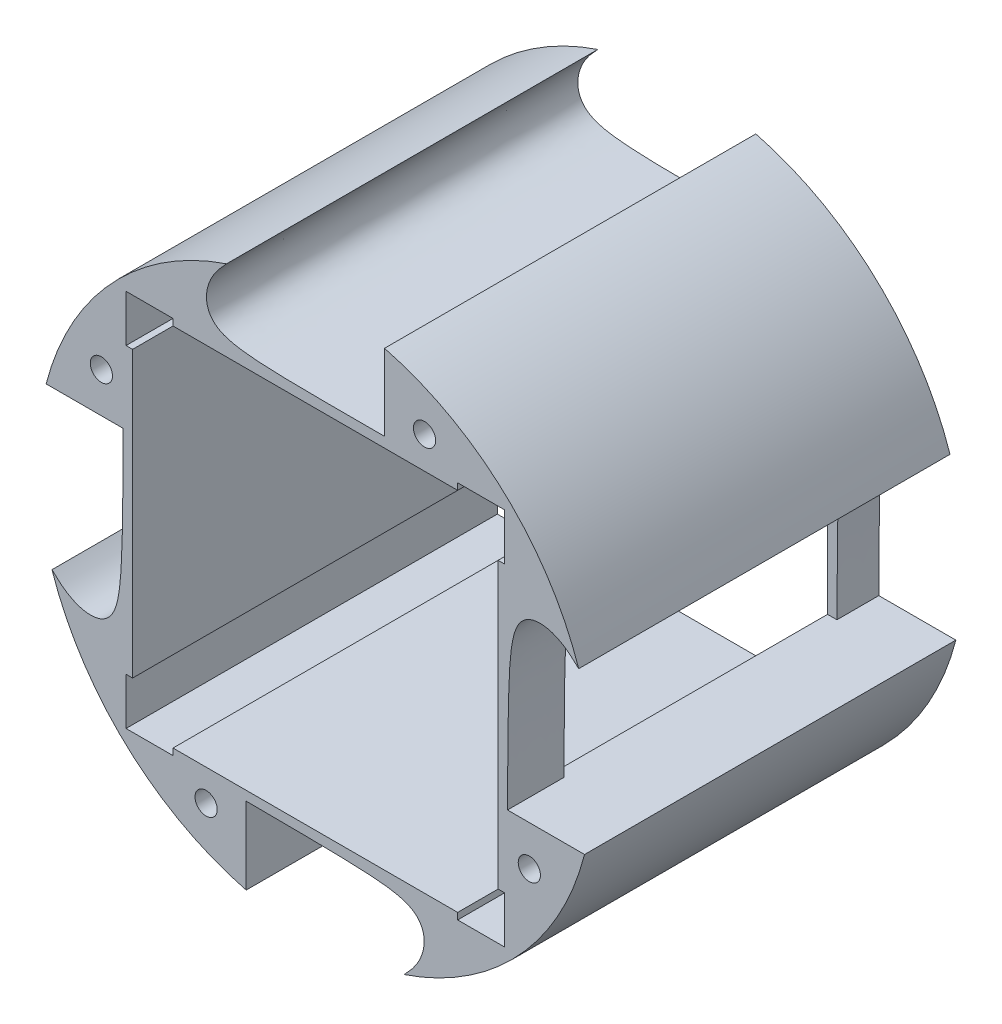
from build123d import *

# Parameters (mm, degrees)
BOSS_EXTRUDE3_OUTLINE_R = 3
BOSS_EXTRUDE3_DEPTH     = 102
CUT_EXTRUDE1_DEPTH      = 102
CUT_EXTRUDE2_DEPTH      = 102
SKETCH4_W               = 0.4
SKETCH4_H               = 1.8
SKETCH4_W_2             = 1.8
SKETCH4_H_2             = 0.4
BOSS_EXTRUDE4_DEPTH     = 102
SKETCH5_W               = 75
SKETCH5_H               = 43.392810524
CUT_EXTRUDE6_DEPTH      = 10
SKETCH7_R               = 3.05
CUT_EXTRUDE9_DEPTH      = 147.084376475


# Read off the part's stored shape, not the designer's step: Boss-Extrude3
with BuildPart() as part:
    # Boss-Extrude3 outline → Boss-Extrude3 (new body)
    with BuildSketch(Plane.XY):
        with BuildLine():
            add(Edge.make_bspline(
                [(24.392810524, -72.348554199), (27.040667073, -69.541086329), (29.089162938, -67.428574969), (30.241441862, -64.355831171), (31.073643307, -60.963009895), (30.561519341, -59.042545022), (29.217193929, -56.673971678), (27.488775543, -54.241382838), (25.105954954, -53), (17.37432721, -53), (-19, -52.782560411)],
                knots=[0, 0, 0, 0, 0, 0, 0, 0, 0, 0, 0, 1, 1, 1, 1, 1, 1, 1, 1, 1, 1, 1], degree=10))
            ThreePointArc((24.392810524, -72.348554199), (55.939709188, -51.962211615), (73.948106805, -19))
            Line((73.948106805, -19), (52.782560411, -19))
            add(Edge.make_bspline(
                [(72.348554199, 24.392810524), (69.541086329, 27.040667073), (67.428574969, 29.089162938), (64.355831171, 30.241441862), (60.963009895, 31.073643307), (59.042545022, 30.561519341), (56.673971678, 29.217193929), (54.241382838, 27.488775543), (53, 25.105954954), (53, 17.37432721), (52.782560411, -19)],
                knots=[0, 0, 0, 0, 0, 0, 0, 0, 0, 0, 0, 1, 1, 1, 1, 1, 1, 1, 1, 1, 1, 1], degree=10))
            ThreePointArc((72.348554199, 24.392810524), (51.962211615, 55.939709188), (19, 73.948106805))
            Line((19, 73.948106805), (19, 53))
            add(Edge.make_bspline(
                [(-24.392810524, 72.348554199), (-27.040667073, 69.541086329), (-29.089162938, 67.428574969), (-30.241441862, 64.355831171), (-31.073643307, 60.963009895), (-30.561519341, 59.042545022), (-29.217193929, 56.673971678), (-27.488775543, 54.241382838), (-25.105954954, 53), (-17.37432721, 53), (19, 53)],
                knots=[0, 0, 0, 0, 0, 0, 0, 0, 0, 0, 0, 1, 1, 1, 1, 1, 1, 1, 1, 1, 1, 1], degree=10))
            ThreePointArc((-24.392810524, 72.348554199), (-55.939709188, 51.962211615), (-73.948106805, 19))
            Line((-73.948106805, 19), (-52.782560411, 19))
            add(Edge.make_bspline(
                [(-72.348554199, -24.392810524), (-69.541086329, -27.040667073), (-67.428574969, -29.089162938), (-64.355831171, -30.241441862), (-60.963009895, -31.073643307), (-59.042545022, -30.561519341), (-56.673971678, -29.217193929), (-54.241382838, -27.488775543), (-53, -25.105954954), (-53, -17.37432721), (-52.782560411, 19)],
                knots=[0, 0, 0, 0, 0, 0, 0, 0, 0, 0, 0, 1, 1, 1, 1, 1, 1, 1, 1, 1, 1, 1], degree=10))
            ThreePointArc((-72.348554199, -24.392810524), (-51.962211615, -55.939709188), (-19, -73.948106805))
            Line((-19, -73.948106805), (-19, -52.782560411))
        make_face()
        with Locations((-30, -58.782560411)):
            Circle(BOSS_EXTRUDE3_OUTLINE_R, mode=Mode.SUBTRACT)
        with Locations((58.782560411, -30)):
            Circle(BOSS_EXTRUDE3_OUTLINE_R, mode=Mode.SUBTRACT)
        with Locations((-58.782560411, 30)):
            Circle(BOSS_EXTRUDE3_OUTLINE_R, mode=Mode.SUBTRACT)
        Polygon((-38.9, -51.6), (-51.6, -51.6), (-51.6, -38.9), (-50, -38.9), (-50, 38.9), (-51.6, 38.9), (-51.6, 51.6), (-38.9, 51.6), (-38.9, 50), (38.9, 50), (38.9, 51.6), (51.6, 51.6), (51.6, 38.9), (50, 38.9), (50, -38.9), (51.6, -38.9), (51.6, -51.6), (38.9, -51.6), (38.9, -50), (-38.9, -50), align=None, mode=Mode.SUBTRACT)
        with Locations((30, 59)):
            Circle(BOSS_EXTRUDE3_OUTLINE_R, mode=Mode.SUBTRACT)
    extrude(amount=BOSS_EXTRUDE3_DEPTH)

    # Sketch2 → Cut-Extrude1 (cut)
    with BuildSketch(Plane.XY.offset(102)):
        Polygon((51.8, -38.7), (50.2, -38.7), (50.2, 38.7), (51.8, 38.7), (51.8, 51.8), (38.7, 51.8), (38.7, 50.2), (-38.7, 50.2), (-38.7, 51.8), (-51.8, 51.8), (-51.8, 38.7), (-50.2, 38.7), (-50.2, -38.7), (-51.8, -38.7), (-51.8, -51.8), (-38.7, -51.8), (-38.7, -50.2), (38.7, -50.2), (38.7, -51.8), (51.8, -51.8), align=None)
        Polygon((51.6, -38.9), (50, -38.9), (50, 38.9), (51.6, 38.9), (51.6, 51.6), (38.9, 51.6), (38.9, 50), (-38.9, 50), (-38.9, 51.6), (-51.6, 51.6), (-51.6, 38.9), (-50, 38.9), (-50, -38.9), (-51.6, -38.9), (-51.6, -51.6), (-38.9, -51.6), (-38.9, -50), (38.9, -50), (38.9, -51.6), (51.6, -51.6), align=None, mode=Mode.SUBTRACT)
    extrude(amount=-CUT_EXTRUDE1_DEPTH, mode=Mode.SUBTRACT)

    # Sketch3 → Cut-Extrude2 (cut)
    with BuildSketch(Plane.XY.offset(102)):
        Polygon((-51.8, -51.8), (-38.7, -51.8), (-38.7, -52), (-52, -52), (-52, -38.7), (-51.8, -38.7), align=None)
        Polygon((38.7, -51.8), (51.8, -51.8), (51.8, -38.7), (52, -38.7), (52, -52), (38.7, -52), align=None)
        Polygon((51.8, 38.7), (51.8, 51.8), (38.7, 51.8), (38.7, 52), (52, 52), (52, 38.7), align=None)
        Polygon((-51.8, 51.8), (-51.8, 38.7), (-52, 38.7), (-52, 52), (-38.7, 52), (-38.7, 51.8), align=None)
    extrude(amount=-CUT_EXTRUDE2_DEPTH, mode=Mode.SUBTRACT)

    # Sketch4 → Boss-Extrude4 (add)
    with BuildSketch(Plane.XY.offset(102)):
        with Locations((-38.9, 51.1)):
            Rectangle(SKETCH4_W, SKETCH4_H)
        with Locations((-51.1, 38.9)):
            Rectangle(SKETCH4_W_2, SKETCH4_H_2)
        with Locations((38.9, 51.1)):
            Rectangle(SKETCH4_W, SKETCH4_H)
        with Locations((51.1, 38.9)):
            Rectangle(SKETCH4_W_2, SKETCH4_H_2)
        with Locations((38.9, -51.1)):
            Rectangle(SKETCH4_W, SKETCH4_H)
        with Locations((51.1, -38.9)):
            Rectangle(SKETCH4_W_2, SKETCH4_H_2)
        with Locations((-51.1, -38.9)):
            Rectangle(SKETCH4_W_2, SKETCH4_H_2)
        with Locations((-38.9, -51.1)):
            Rectangle(SKETCH4_W, SKETCH4_H)
    extrude(amount=-BOSS_EXTRUDE4_DEPTH)

    # Sketch5 → Cut-Extrude6 (cut)
    with BuildSketch(Plane.ZY.offset(-50.2)):
        with Locations((49, 2.696405262)):
            Rectangle(SKETCH5_W, SKETCH5_H)
    extrude(amount=-CUT_EXTRUDE6_DEPTH, mode=Mode.SUBTRACT)

    # Sketch7 → Cut-Extrude9 (cut, through all)
    with BuildSketch(Plane(origin=(0, 0, 0), x_dir=(-1, 0, 0), z_dir=(0, 0, -1))):
        with Locations((30, -58.782560411)):
            Circle(SKETCH7_R)
        with Locations((-58.782560411, -30)):
            Circle(SKETCH7_R)
        with Locations((58.782560411, 30)):
            Circle(SKETCH7_R)
        with Locations((-30, 59)):
            Circle(SKETCH7_R)
    extrude(amount=-CUT_EXTRUDE9_DEPTH, mode=Mode.SUBTRACT)


solid = part.part
